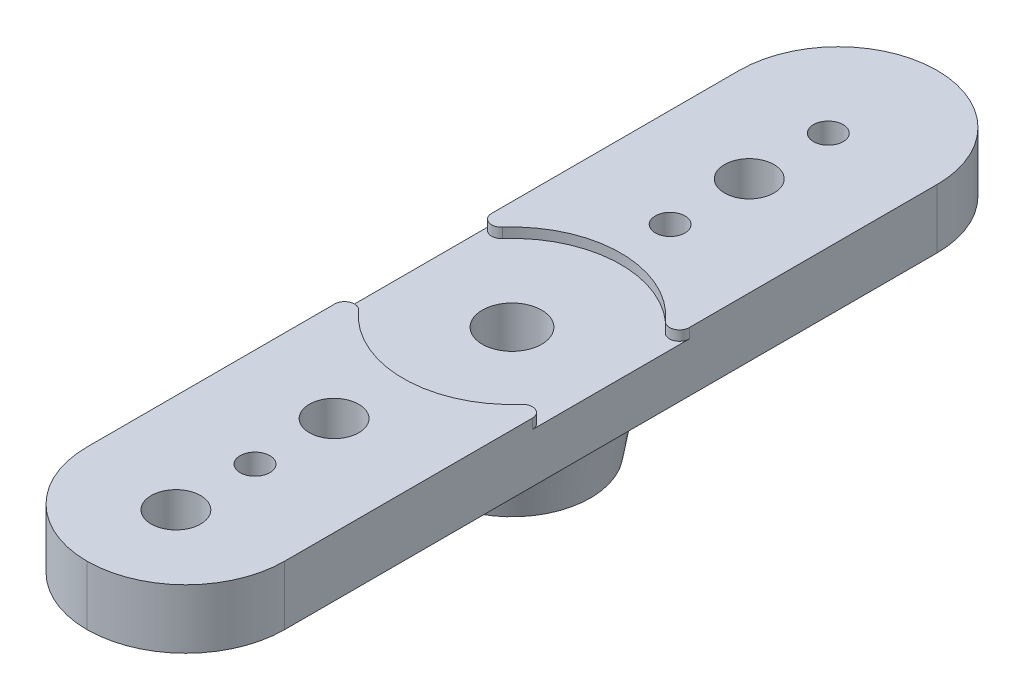
from build123d import *

# Parameters (mm, degrees)
SKETCH1_W           = 10
SKETCH1_H           = 43
BOSS_EXTRUDE1_DEPTH = 3
FILLET1_R           = 5
SKETCH2_R           = 4.5
BOSS_EXTRUDE2_DEPTH = 3
DRAFT1_ANGLE        = 10
SKETCH3_R           = 3
CUT_EXTRUDE1_DEPTH  = 3
SKETCH4_R           = 1.5
CUT_EXTRUDE2_DEPTH  = 23.27666941
SKETCH5_R           = 5.5
CUT_EXTRUDE3_DEPTH  = 0.5
FILLET2_R           = 0.5
SKETCH6_R           = 1.25
SKETCH6_R_2         = 0.75
CUT_EXTRUDE4_DEPTH  = 23.874658467


with BuildPart() as part:
    # Sketch1 → Boss-Extrude1 (new body)
    with BuildSketch(Plane(origin=(0, 0, 0), x_dir=(1, 0, 0), z_dir=(0, 1, 0))):
        Rectangle(SKETCH1_W, SKETCH1_H)
    extrude(amount=BOSS_EXTRUDE1_DEPTH)

    # Fillet1
    fillet1_edges = [part.edges().sort_by_distance(p)[0] for p in [
        (-5, 1.5, -21.5),
        (5, 1.5, -21.5),
        (5, 1.5, 21.5),
        (-5, 1.5, 21.5),
    ]]
    fillet(fillet1_edges, radius=FILLET1_R - 0.0001)  # a hair under: the kernel refuses the full size

    # Sketch2 → Boss-Extrude2 (add)
    with BuildSketch(Plane(origin=(0, 0, 0), x_dir=(1, 0, 0), z_dir=(0, 1, 0))):
        with Locations(Location((0, 0, 0), (0, 0, 270))):
            Circle(SKETCH2_R)
    extrude(amount=-BOSS_EXTRUDE2_DEPTH)

    # Draft1
    draft1_faces = [part.faces().sort_by_distance(p)[0] for p in [
        (0, -1.5, -4.5),
    ]]
    draft(draft1_faces, Plane(origin=(0, 0, 0), x_dir=(0, 0, -1), z_dir=(0, -1, 0)), DRAFT1_ANGLE)

    # Sketch3 → Cut-Extrude1 (cut)
    with BuildSketch(Plane.XZ.offset(3)):
        with Locations(Location((0, 0, 0), (0, 0, 270))):
            Circle(SKETCH3_R)
    extrude(amount=-CUT_EXTRUDE1_DEPTH, mode=Mode.SUBTRACT)

    # Sketch4 → Cut-Extrude2 (cut, through all)
    with BuildSketch(Plane.XZ):
        with Locations(Location((0, 0, 0), (0, 0, 270))):
            Circle(SKETCH4_R)
    extrude(amount=-CUT_EXTRUDE2_DEPTH, mode=Mode.SUBTRACT)

    # Sketch5 → Cut-Extrude3 (cut)
    with BuildSketch(Plane(origin=(0, 3, 0), x_dir=(1, 0, 0), z_dir=(0, 1, 0))):
        Circle(SKETCH5_R)
    extrude(amount=-CUT_EXTRUDE3_DEPTH, mode=Mode.SUBTRACT)

    # Fillet2
    fillet2_edges = [part.edges().sort_by_distance(p)[0] for p in [
        (-5, 2.75, -2.291287847),
        (5, 2.75, -2.291287847),
        (-5, 2.75, 2.291287847),
        (5, 2.75, 2.291287847),
    ]]
    fillet(fillet2_edges, radius=FILLET2_R)

    # Sketch6 → Cut-Extrude4 (cut, through all)
    with BuildSketch(Plane(origin=(0, 3, 0), x_dir=(1, 0, 0), z_dir=(0, 1, 0))):
        with Locations(Location((0, 12, 0), (0, 0, 270))):
            Circle(SKETCH6_R)
        with Locations(Location((0, 16, 0), (0, 0, 270))):
            Circle(SKETCH6_R_2)
        with Locations(Location((0, 8, 0), (0, 0, 270))):
            Circle(SKETCH6_R_2)
        with Locations(Location((0, -17, 0), (0, 0, 270))):
            Circle(SKETCH6_R)
        with Locations(Location((0, -9, 0), (0, 0, 270))):
            Circle(SKETCH6_R)
        with Locations(Location((0, -13, 0), (0, 0, 270))):
            Circle(SKETCH6_R_2)
    extrude(amount=-CUT_EXTRUDE4_DEPTH, mode=Mode.SUBTRACT)


solid = part.part
